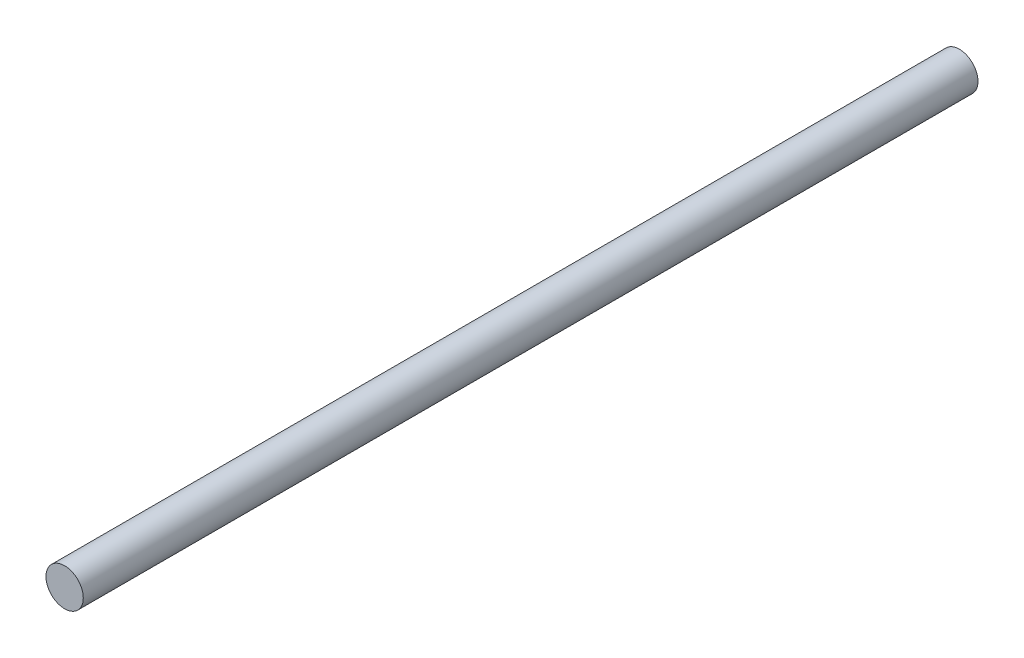
from build123d import *

# Parameters (mm, degrees)
SKETCH1_R           = 3.175
BOSS_EXTRUDE1_DEPTH = 152.24


with BuildPart() as part:
    # Sketch1 → Boss-Extrude1 (new body)
    with BuildSketch(Plane.XY):
        Circle(SKETCH1_R)
    extrude(amount=BOSS_EXTRUDE1_DEPTH)


solid = part.part
